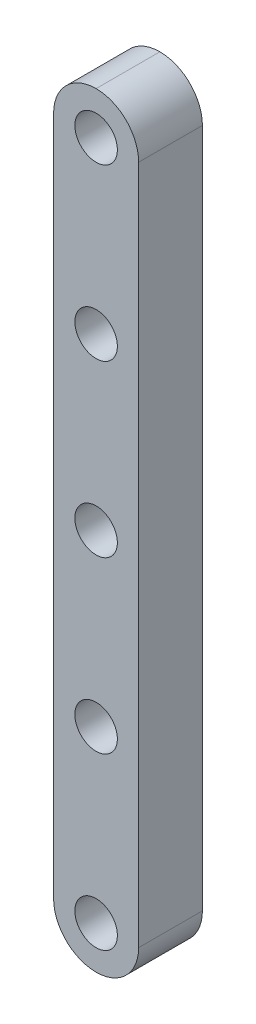
from build123d import *

# Parameters (mm, degrees)
SKETCH_1_W      = 20
SKETCH_1_H      = 180
SKETCH_1_R      = 5
EXTRUDE_1_DEPTH = 15
FILLET_1_R      = 10


with BuildPart() as part:
    # 草图1 → 凸台-拉伸1 (new body)
    with BuildSketch(Plane.XY):
        Rectangle(SKETCH_1_W, SKETCH_1_H)
        with Locations((0, -80)):
            Circle(SKETCH_1_R, mode=Mode.SUBTRACT)
        with Locations(Location((0, 80, 0), (0, 0, 180))):
            Circle(SKETCH_1_R, mode=Mode.SUBTRACT)
        Circle(SKETCH_1_R, mode=Mode.SUBTRACT)
        with Locations((0, -40)):
            Circle(SKETCH_1_R, mode=Mode.SUBTRACT)
        with Locations((0, 40)):
            Circle(SKETCH_1_R, mode=Mode.SUBTRACT)
    extrude(amount=EXTRUDE_1_DEPTH)

    # 圆角1
    fillet_1_edges = [part.edges().sort_by_distance(p)[0] for p in [
        (-10, -90, 7.5),
        (10, -90, 7.5),
        (10, 90, 7.5),
        (-10, 90, 7.5),
    ]]
    fillet(fillet_1_edges, radius=FILLET_1_R - 0.0001)  # a hair under: the kernel refuses the full size


solid = part.part
